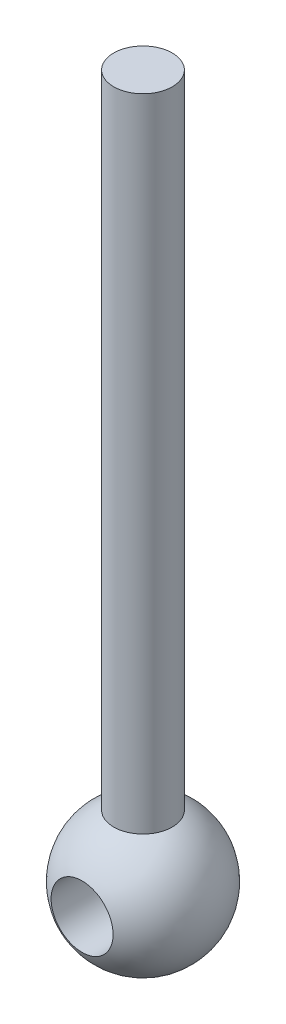
from build123d import *

# Parameters (mm, degrees)
REVOLVE1_ANGLE      = 359.999695921
BOSS_EXTRUDE1_START = 3.5
SKETCH2_R           = 3
BOSS_EXTRUDE1_DEPTH = 68.5


with BuildPart() as part:
    # Sketch1 → Revolve1 (revolve)
    with BuildSketch(Plane(origin=(0, 0, 0), x_dir=(1, 0, 0), z_dir=(0, 1, 0))):
        with BuildLine():
            Line((3.175, 6.238539493), (3.175, -6.238539493))
            ThreePointArc((3.175, -6.238539493), (7, 0), (3.175, 6.238539493))
        make_face()
    revolve(axis=Axis((0, 0, 6.238539493), (0, 0, -1)), revolution_arc=REVOLVE1_ANGLE)

    # Sketch2 → Boss-Extrude1 (add)
    with BuildSketch(Plane(origin=(0, 0, 0), x_dir=(1, 0, 0), z_dir=(0, 1, 0)).offset(BOSS_EXTRUDE1_START)):
        Circle(SKETCH2_R)
    extrude(amount=BOSS_EXTRUDE1_DEPTH)


solid = part.part
